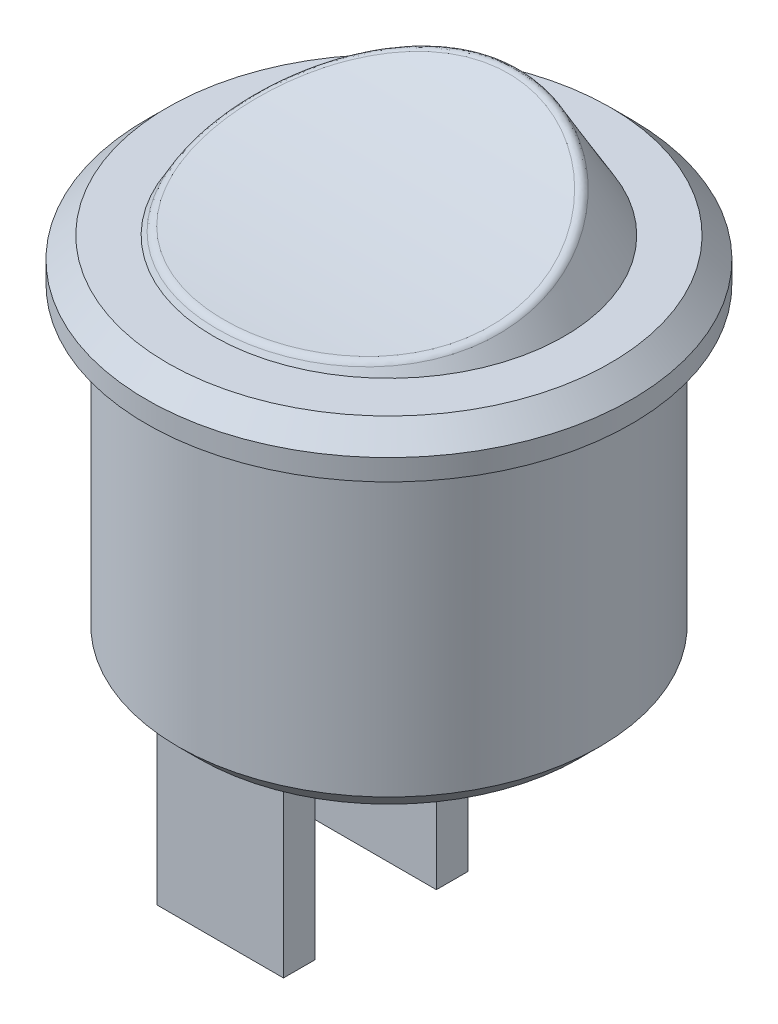
from build123d import *

# Parameters (mm, degrees)
SKETCH3_R               = 9
BOSS_EXTRUDE1_DEPTH     = 4
CHAMFER1_SIZE           = 5.196152423
CHAMFER1_SIZE_2         = 3
CUT_EXTRUDE2_DEPTH      = 27.561249971
CUT_EXTRUDE2_DEPTH_BACK = 27.561249971
FILLET1_R               = 0.4
SKETCH6_W               = 1.050125629
SKETCH6_H               = 2
BOSS_EXTRUDE2_DEPTH     = 3
SKETCH7_W               = 6
SKETCH7_H               = 1.5
BOSS_EXTRUDE3_DEPTH     = 8
CHAMFER2_SIZE           = 1


with BuildPart() as part:
    # Sketch2 → Revolve1 (revolve)
    with BuildSketch(Plane(origin=(0, 0, 0), x_dir=(0, 0, -1), z_dir=(1, 0, 0))):
        Polygon((0, 0), (0, 17), (10.5, 17), (11.5, 16), (11.5, 15), (10, 15), (10, 0), align=None)
    revolve(axis=Axis((0, 0, 0), (0, 1, 0)))

    # Sketch3 → Boss-Extrude1 (add)
    with BuildSketch(Plane(origin=(0, 17, 0), x_dir=(1, 0, 0), z_dir=(0, 1, 0))):
        with Locations(Location((0, 0, 0), (0, 0, 270))):
            Circle(SKETCH3_R)
    extrude(amount=BOSS_EXTRUDE1_DEPTH)

    # Chamfer1
    # the kernel refuses this chamfer: 5.196152423, 3 mm, written as the material it takes off along each edge
    with BuildSketch(Plane(origin=(0, 21, 0), x_dir=(0, 0, 1), z_dir=(-1, 0, 0))) as chamfer1_piece_1_section:
        Polygon((9, -CHAMFER1_SIZE), (9 - CHAMFER1_SIZE_2, 0), (9, 0), align=None)
    chamfer1_piece_1 = revolve(axis=Axis((0, 21, 0), (0, 1, 0)), mode=Mode.PRIVATE)
    chamfer1_piece_1 = split(chamfer1_piece_1, bisect_by=Plane(origin=(0, 17, -7.167132971), z_dir=(0, 1, 0)), keep=Keep.TOP, mode=Mode.PRIVATE)
    add(chamfer1_piece_1, mode=Mode.SUBTRACT)

    # Sketch5 → Cut-Extrude2 (cut, two sides: drawn at the far end of the back side and taken through both)
    with BuildSketch(Plane(origin=(0, 0, 0), x_dir=(0, 0, -1), z_dir=(1, 0, 0)).offset(-CUT_EXTRUDE2_DEPTH_BACK)):
        with BuildLine():
            Line((6, 21), (-6, 21))
            Line((-6, 21), (-8.085535149, 17.44220036))
            ThreePointArc((-8.085535149, 17.44220036), (-0.821567104, 18.345354686), (6, 21))
        make_face()
    extrude(amount=CUT_EXTRUDE2_DEPTH + CUT_EXTRUDE2_DEPTH_BACK, mode=Mode.SUBTRACT)

    # Fillet1
    fillet1_edges = [part.edges().sort_by_distance(p)[0] for p in [
        (-9.3e-08, 21, -6),
    ]]
    fillet(fillet1_edges, radius=FILLET1_R)

    # Sketch6 → Boss-Extrude2 (add)
    with BuildSketch(Plane.XZ.offset(-15)):
        with Locations((-10.474937185, 0)):
            Rectangle(SKETCH6_W, SKETCH6_H)
    extrude(amount=BOSS_EXTRUDE2_DEPTH)

    # Sketch7 → Boss-Extrude3 (add)
    with BuildSketch(Plane.XZ):
        Rectangle(SKETCH7_W, SKETCH7_H)
        with Locations((0, 7.25)):
            Rectangle(SKETCH7_W, SKETCH7_H)
    extrude(amount=BOSS_EXTRUDE3_DEPTH)

    # Chamfer2
    chamfer2_edges = [part.edges().sort_by_distance(p)[0] for p in [
        (0, 0, 10),
    ]]
    chamfer(chamfer2_edges, length=CHAMFER2_SIZE)


solid = part.part
